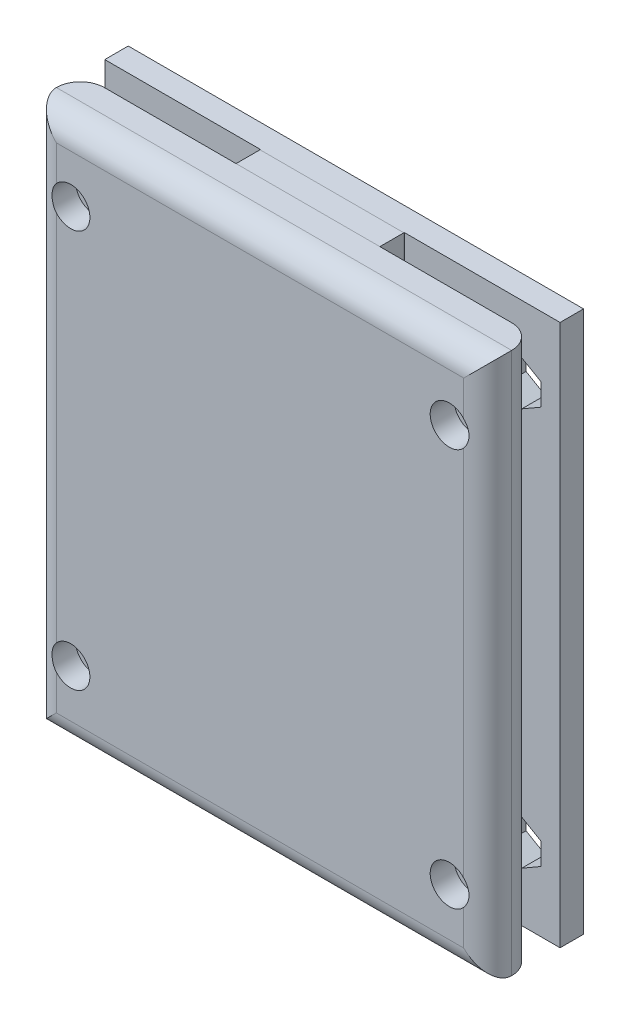
from build123d import *

# Parameters (mm, degrees)
CROQUIS1_W                 = 95
CROQUIS1_H                 = 113
SALIENTE_EXTRUIR1_DEPTH    = 5
CROQUIS2_W                 = 30
CROQUIS2_H                 = 113
SALIENTE_EXTRUIR2_DEPTH    = 5
CROQUIS3_W                 = 95
CROQUIS3_H                 = 113
SALIENTE_EXTRUIR3_DEPTH    = 10
CORTAR_EXTRUIR3_DEPTH      = 77.475486268
CORTAR_EXTRUIR3_DEPTH_BACK = 5
CROQUIS4_R                 = 4
CROQUIS5_R                 = 2.5
CORTAR_EXTRUIR7_DEPTH      = 77.475486268
REDONDEO3_R                = 5
REDONDEO2_R                = 5
CROQUIS6_W                 = 32.5
CROQUIS6_H                 = 113
CORTAR_EXTRUIR8_DEPTH      = 0.1


# Some blends are built 0.0001 mm under size
with BuildPart() as part:
    # Croquis1 → Saliente-Extruir1 (new body)
    with BuildSketch(Plane.XY):
        Rectangle(CROQUIS1_W, CROQUIS1_H)
        Polygon((-35.5, 39.190598923), (-35.5, 43.809401077), (-39.5, 46.118802154), (-43.5, 43.809401077), (-43.5, 39.190598923), (-39.5, 36.881197846), align=None, mode=Mode.SUBTRACT)
        Polygon((-35.5, -43.809401077), (-35.5, -39.190598923), (-39.5, -36.881197846), (-43.5, -39.190598923), (-43.5, -43.809401077), (-39.5, -46.118802154), align=None, mode=Mode.SUBTRACT)
        Polygon((39.5, -46.118802154), (35.5, -43.809401077), (35.5, -39.190598923), (39.5, -36.881197846), (43.5, -39.190598923), (43.5, -43.809401077), align=None, mode=Mode.SUBTRACT)
        Polygon((39.5, 36.881197846), (35.5, 39.190598923), (35.5, 43.809401077), (39.5, 46.118802154), (43.5, 43.809401077), (43.5, 39.190598923), align=None, mode=Mode.SUBTRACT)
    extrude(amount=SALIENTE_EXTRUIR1_DEPTH)

    # Croquis6 → Cortar-Extruir8 (cut)
    with BuildSketch(Plane.XY.offset(5)):
        with Locations((-31.25, 0)):
            Rectangle(CROQUIS6_W, CROQUIS6_H)
        with Locations((31.25, 0)):
            Rectangle(CROQUIS6_W, CROQUIS6_H)
    extrude(amount=-CORTAR_EXTRUIR8_DEPTH, mode=Mode.SUBTRACT)


with BuildPart() as body_2:
    # Croquis2 → Saliente-Extruir2 (new body)
    with BuildSketch(Plane.XY.offset(5)):
        Rectangle(CROQUIS2_W, CROQUIS2_H)
    extrude(amount=SALIENTE_EXTRUIR2_DEPTH)


with BuildPart() as body_3:
    # Croquis3 → Saliente-Extruir3 (new body)
    with BuildSketch(Plane.XY.offset(10)):
        Rectangle(CROQUIS3_W, CROQUIS3_H)
    extrude(amount=SALIENTE_EXTRUIR3_DEPTH)

    # Croquis4 → Cortar-Extruir3 (cut, two sides: drawn at the far end of the back side and taken through both)
    with BuildSketch(Plane.XY.offset(20).offset(-CORTAR_EXTRUIR3_DEPTH_BACK)):
        with Locations(Location((39.5, 41.5, 0), (0, 0, 180))):
            Circle(CROQUIS4_R)
        with Locations(Location((-39.5, 41.5, 0), (0, 0, 180))):
            Circle(CROQUIS4_R)
        with Locations(Location((-39.5, -41.5, 0), (0, 0, 180))):
            Circle(CROQUIS4_R)
        with Locations(Location((39.5, -41.5, 0), (0, 0, 180))):
            Circle(CROQUIS4_R)
    extrude(amount=CORTAR_EXTRUIR3_DEPTH + CORTAR_EXTRUIR3_DEPTH_BACK, mode=Mode.SUBTRACT)

    # Croquis5 → Cortar-Extruir7 (cut, through all)
    with BuildSketch(Plane.XY.offset(20)):
        with Locations((-39.5, 41.5)):
            Circle(CROQUIS5_R)
        with Locations((39.5, 41.5)):
            Circle(CROQUIS5_R)
        with Locations((-39.5, -41.5)):
            Circle(CROQUIS5_R)
        with Locations((39.5, -41.5)):
            Circle(CROQUIS5_R)
    extrude(amount=-CORTAR_EXTRUIR7_DEPTH, mode=Mode.SUBTRACT)

    # Redondeo3
    # the kernel refuses this fillet: 5 mm, written as the material it takes off along each edge
    with BuildSketch(Plane(origin=(47.5, 69, 20), x_dir=(0, 0, -1), z_dir=(0, -1, 0)), Plane(origin=(-47.5, -69, 20), x_dir=(0, 0, -1), z_dir=(0, 1, 0))) as redondeo3_piece_1:
        with BuildLine():
            CenterArc((REDONDEO3_R, -REDONDEO3_R), REDONDEO3_R, 90, 90)
            Line((0, -REDONDEO3_R), (0, 0))
            Line((0, 0), (REDONDEO3_R, 0))
        make_face()
    extrude(amount=138, mode=Mode.SUBTRACT)
    with BuildSketch(Plane(origin=(-60, 56.5, 20), x_dir=(0, 0, -1), z_dir=(1, 0, 0))) as redondeo3_piece_2:
        with BuildLine():
            CenterArc((REDONDEO3_R, -REDONDEO3_R), REDONDEO3_R, 90, 90)
            Line((0, -REDONDEO3_R), (0, 0))
            Line((0, 0), (REDONDEO3_R, 0))
        make_face()
    extrude(amount=120, mode=Mode.SUBTRACT)
    with BuildSketch(Plane(origin=(60, -56.5, 20), x_dir=(0, 1, 0), z_dir=(-1, 0, 0))) as redondeo3_piece_3:
        with BuildLine():
            CenterArc((REDONDEO3_R, REDONDEO3_R), REDONDEO3_R, 180, 90)
            Line((0, REDONDEO3_R), (0, 0))
            Line((0, 0), (REDONDEO3_R, 0))
        make_face()
    extrude(amount=120, mode=Mode.SUBTRACT)

    # Redondeo2
    redondeo2_edges = [body_3.edges().sort_by_distance(p)[0] for p in [
        (47.5, 0, 10),
        (-47.5, 0, 10),
    ]]
    fillet(redondeo2_edges, radius=REDONDEO2_R - 0.0001)  # a hair under: the kernel refuses the full size


solid = Compound([part.part, body_2.part, body_3.part])
